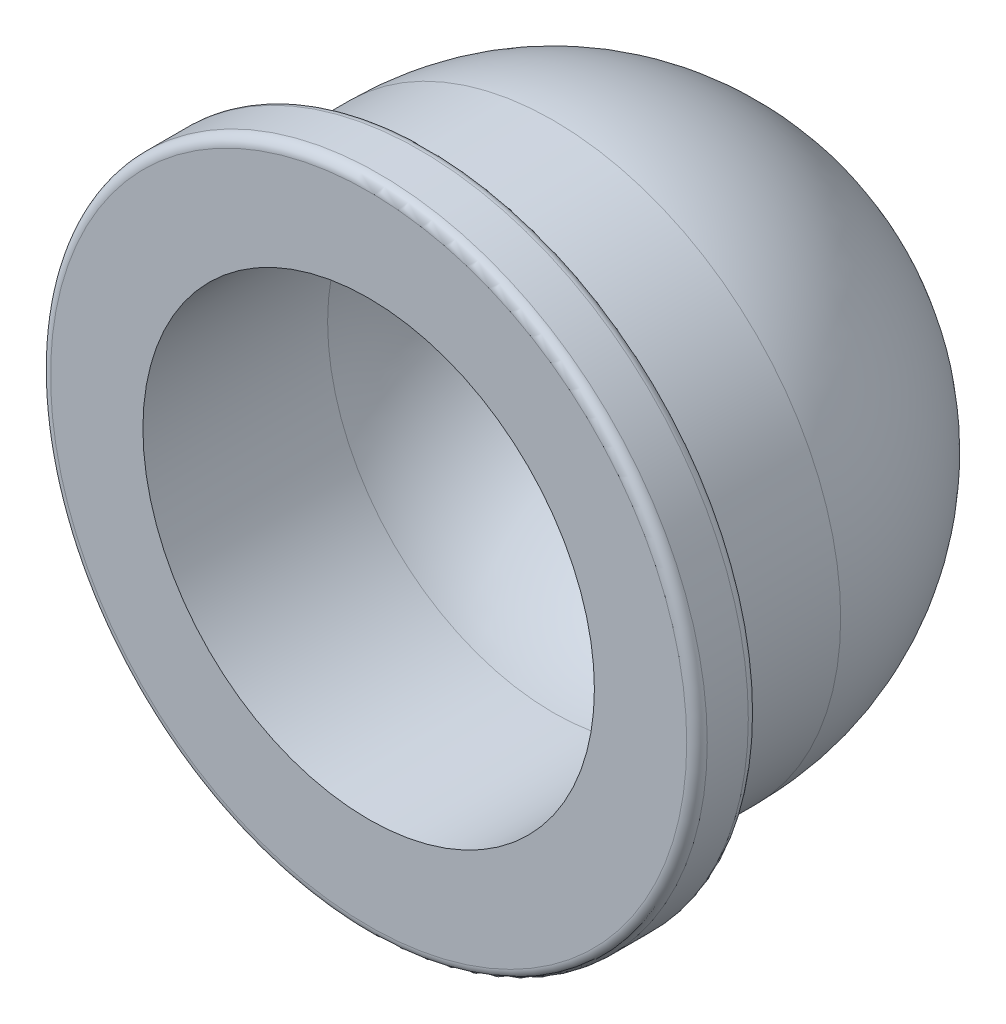
from build123d import *

# Parameters (mm, degrees)
SKETCH2_R           = 7
BOSS_EXTRUDE1_DEPTH = 10
SKETCH3_R           = 8
BOSS_EXTRUDE2_DEPTH = 1.5
FILLET3_R           = 7
FILLET4_R           = 0.25


# Read off the part's stored shape, not the designer's step: Shell1
with BuildPart() as part:
    # Sketch2 → Boss-Extrude1 (new body)
    with BuildSketch(Plane.XY):
        Circle(SKETCH2_R)
    extrude(amount=BOSS_EXTRUDE1_DEPTH)

    # Sketch3 → Boss-Extrude2 (add)
    with BuildSketch(Plane.XY.offset(10)):
        Circle(SKETCH3_R)
    extrude(amount=BOSS_EXTRUDE2_DEPTH)

    # Fillet3
    fillet3_edges = [part.edges().sort_by_distance(p)[0] for p in [
        (-7, 0, 0),
    ]]
    fillet(fillet3_edges, radius=FILLET3_R)

    # Shell1 outline → Shell1 (revolve, cut)
    with BuildSketch(Plane.XZ):
        with BuildLine():
            Line((5.5, 7.000000005), (5.5, 11.5))
            Line((5.5, 11.5), (0, 11.5))
            Line((0, 11.5), (0, 1.5))
            ThreePointArc((0, 1.5), (3.889087298, 3.110912705), (5.5, 7.000000005))
        make_face()
    revolve(axis=Axis((0, 0, 0), (0, 0, 1)), mode=Mode.SUBTRACT)

    # Fillet4
    fillet4_edges = [part.edges().sort_by_distance(p)[0] for p in [
        (-8, 0, 10),
        (-8, 0, 11.5),
    ]]
    fillet(fillet4_edges, radius=FILLET4_R)


solid = part.part
